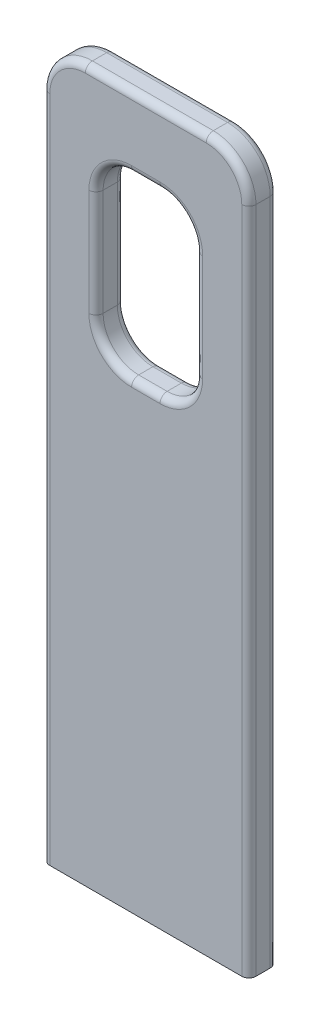
from build123d import *

# Parameters (mm, degrees)
SKETCH1_W      = 2.9
SKETCH1_H      = 10
SKETCH1_W_2    = 1.4
SKETCH1_H_2    = 2.5
EXTRUDE1_DEPTH = 0.2
FILLET1_R      = 0.5
FILLET2_R      = 0.6
FILLET3_R      = 0.1


with BuildPart() as part:
    # Sketch1 → Extrude1 (new, symmetric)
    with BuildSketch(Plane.XY):
        with Locations((0, 5)):
            Rectangle(SKETCH1_W, SKETCH1_H)
        with Locations((0, 7.75)):
            Rectangle(SKETCH1_W_2, SKETCH1_H_2, mode=Mode.SUBTRACT)
    extrude(amount=EXTRUDE1_DEPTH, both=True)

    # Fillet1
    fillet1_edges = [part.edges().sort_by_distance(p)[0] for p in [
        (0.7, 6.5, 0),
        (0.7, 9, 0),
        (-0.7, 9, 0),
        (-0.7, 6.5, 0),
    ]]
    fillet(fillet1_edges, radius=FILLET1_R)

    # Fillet2
    fillet2_edges = [part.edges().sort_by_distance(p)[0] for p in [
        (1.45, 10, 0),
        (-1.45, 10, 0),
    ]]
    fillet(fillet2_edges, radius=FILLET2_R)

    # Fillet3
    fillet3_edges = [part.edges().sort_by_distance(p)[0] for p in [
        (-1.45, 4.7, -0.2),
        (-1.274264069, 9.824264069, -0.2),
        (0, 10, -0.2),
        (1.274264069, 9.824264069, -0.2),
        (-1.45, 4.7, 0.2),
        (-1.274264069, 9.824264069, 0.2),
        (0, 10, 0.2),
        (1.274264069, 9.824264069, 0.2),
        (1.45, 4.7, -0.2),
        (1.45, 4.7, 0.2),
        (-0.553553391, 8.853553391, 0.2),
        (0, 9, 0.2),
        (0.553553391, 8.853553391, 0.2),
        (0.7, 7.75, 0.2),
        (0.553553391, 6.646446609, 0.2),
        (0, 6.5, 0.2),
        (-0.553553391, 6.646446609, 0.2),
        (-0.553553391, 8.853553391, -0.2),
        (0, 9, -0.2),
        (0.553553391, 8.853553391, -0.2),
        (0.7, 7.75, -0.2),
        (0.553553391, 6.646446609, -0.2),
        (0, 6.5, -0.2),
        (-0.553553391, 6.646446609, -0.2),
        (-0.7, 7.75, 0.2),
        (-0.7, 7.75, -0.2),
    ]]
    fillet(fillet3_edges, radius=FILLET3_R)


solid = part.part
